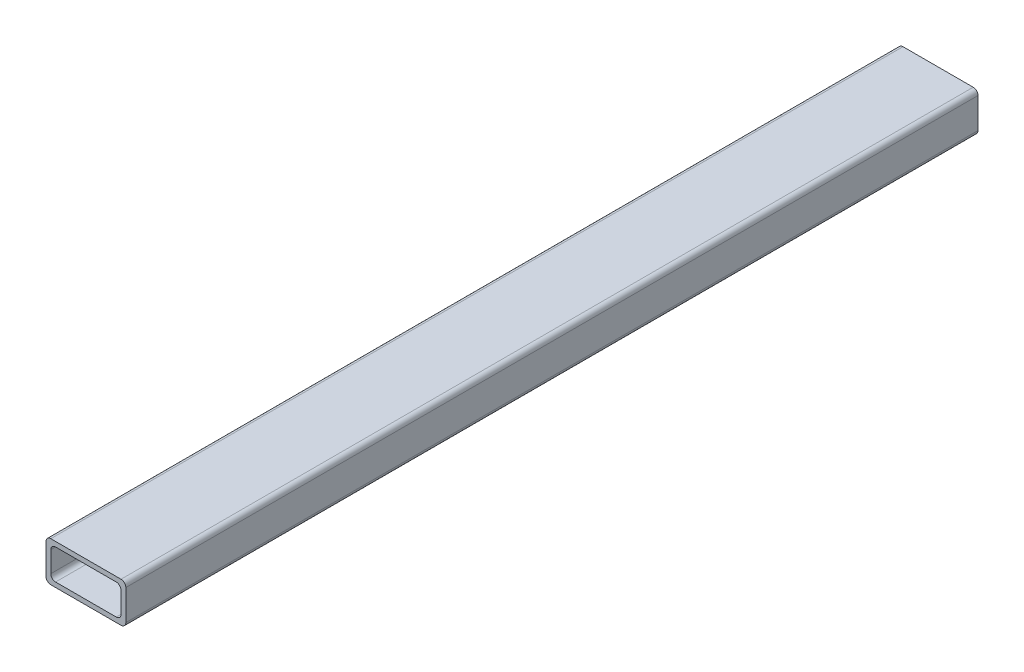
from build123d import *

# Parameters (mm, degrees)
SKETCH1_W           = 50.8
SKETCH1_H           = 25.4
SKETCH1_W_2         = 44.704
SKETCH1_H_2         = 19.304
BOSS_EXTRUDE1_DEPTH = 542.417
VARFILLET1_R        = 3.048


with BuildPart() as part:
    # Sketch1 → Boss-Extrude1 (new body)
    with BuildSketch(Plane.XY):
        with Locations((22.352, 9.652)):
            Rectangle(SKETCH1_W, SKETCH1_H)
        with Locations((22.352, 9.652)):
            Rectangle(SKETCH1_W_2, SKETCH1_H_2, mode=Mode.SUBTRACT)
    extrude(amount=BOSS_EXTRUDE1_DEPTH)

    # VarFillet1
    varfillet1_edges = [part.edges().sort_by_distance(p)[0] for p in [
        (0, 19.304, 271.2085),
        (0, 0, 271.2085),
        (44.704, 19.304, 271.2085),
        (44.704, 0, 271.2085),
        (47.752, -3.048, 271.2085),
        (47.752, 22.352, 271.2085),
        (-3.048, 22.352, 271.2085),
        (-3.048, -3.048, 271.2085),
    ]]
    fillet(varfillet1_edges, radius=VARFILLET1_R)


solid = part.part
